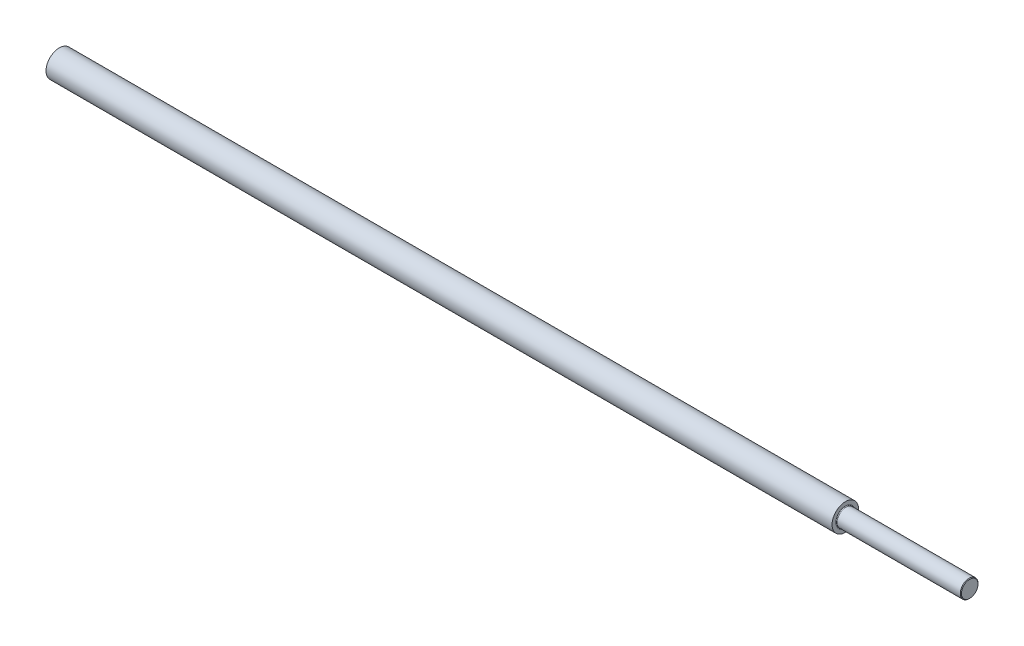
from build123d import *


with BuildPart() as part:
    # Sketch1 → Revolve1 (revolve)
    with BuildSketch(Plane.XY):
        with BuildLine():
            Line((0, 0), (0, 6))
            Line((0, 6), (354, 6))
            Line((354, 6), (354, 4.3))
            ThreePointArc((354, 4.3), (354.087867966, 4.087867966), (354.3, 4))
            Line((354.3, 4), (409.733333333, 4))
            Line((409.733333333, 4), (410, 3.733333333))
            Line((410, 3.733333333), (410, 0))
            Line((410, 0), (0, 0))
        make_face()
    revolve(axis=Axis((410, 0, 0), (-1, 0, 0)))


solid = part.part
